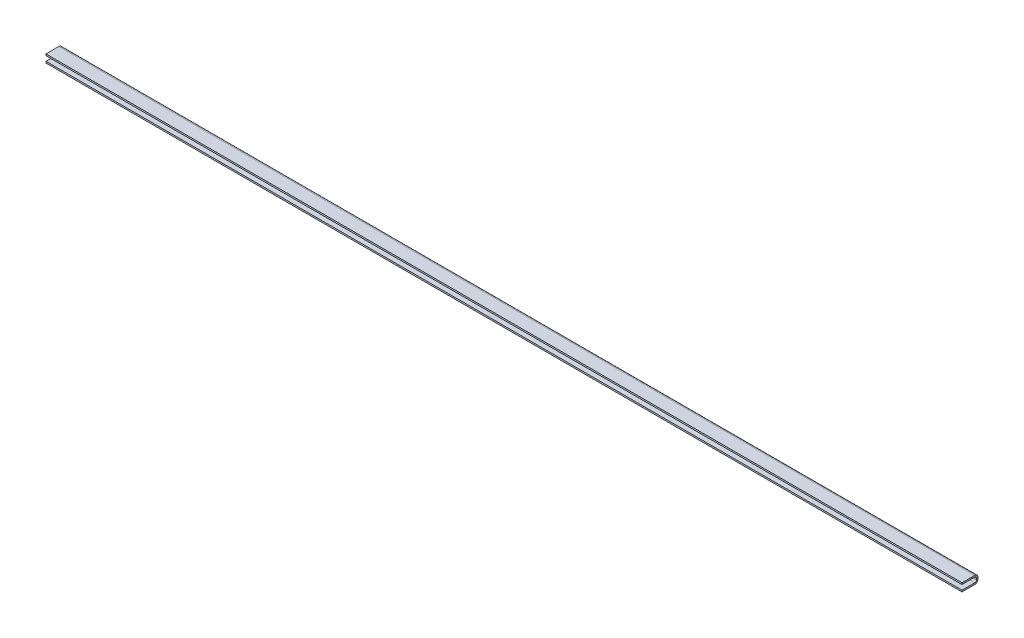
from build123d import *

# Parameters (mm, degrees)
SKETCH_1_W                         = 1144
SKETCH_1_H                         = 10
SM_BASE_FLANGE_1_DEPTH             = 2
SM_EDGE_FLANGE_1_STRIP_W           = 12
SM_EDGE_FLANGE_1_STRIP_H           = 2
SM_EDGE_FLANGE_1_STRIP_CUT_DEPTH   = 1144
SM_EDGE_FLANGE_1_STRIP_2_W         = 12
SM_EDGE_FLANGE_1_STRIP_2_H         = 2
SM_EDGE_FLANGE_1_STRIP_CUT_2_DEPTH = 1144
SM_EDGE_FLANGE_1_DEPTH             = 1144
SM_EDGE_FLANGE_1_BEND_DEPTH        = 1144


# Sheet-metal steps are written as plain solids
with BuildPart() as part:
    # Sketch 1 → 基体-法兰1 (new body)
    with BuildSketch(Plane.XY):
        Rectangle(SKETCH_1_W, SKETCH_1_H)
    extrude(amount=-SM_BASE_FLANGE_1_DEPTH)

    # 边线-法兰1 strip (across the edge) → 边线-法兰1 strip cut (cut)
    with BuildSketch(Plane(origin=(572, 5, 0), x_dir=(0, -1, 0), z_dir=(-1, 0, 0))):
        with Locations((-2, -1)):
            Rectangle(SM_EDGE_FLANGE_1_STRIP_W, SM_EDGE_FLANGE_1_STRIP_H)
    extrude(amount=SM_EDGE_FLANGE_1_STRIP_CUT_DEPTH, mode=Mode.SUBTRACT)

    # 边线-法兰1 strip 2 (across the edge) → 边线-法兰1 strip cut 2 (cut)
    with BuildSketch(Plane(origin=(-572, -5, 0), x_dir=(0, 1, 0), z_dir=(1, 0, 0))):
        with Locations((-2, -1)):
            Rectangle(SM_EDGE_FLANGE_1_STRIP_2_W, SM_EDGE_FLANGE_1_STRIP_2_H)
    extrude(amount=SM_EDGE_FLANGE_1_STRIP_CUT_2_DEPTH, mode=Mode.SUBTRACT)

    # 边线-法兰1 section (across the edge) → 边线-法兰1 (add)
    with BuildSketch(Plane(origin=(572, 5, 0), x_dir=(0, -1, 0), z_dir=(-1, 0, 0))):
        with BuildLine():
            Line((0, 2), (0, 18))
            Line((0, 18), (2, 18))
            Line((2, 18), (2, 2))
            ThreePointArc((2, 2), (2.585786438, 0.585786438), (4, 0))
            Line((4, 0), (4, -2))
            ThreePointArc((4, -2), (1.171572875, -0.828427125), (0, 2))
        make_face()
    extrude(amount=SM_EDGE_FLANGE_1_DEPTH)

    # 边线-法兰1 section 2 (across the edge) → 边线-法兰1 bend (add)
    with BuildSketch(Plane(origin=(-572, -5, 0), x_dir=(0, 1, 0), z_dir=(1, 0, 0))):
        with BuildLine():
            Line((0, 2), (0, 18))
            Line((0, 18), (2, 18))
            Line((2, 18), (2, 2))
            ThreePointArc((2, 2), (2.585786438, 0.585786438), (4, 0))
            Line((4, 0), (4, -2))
            ThreePointArc((4, -2), (1.171572875, -0.828427125), (0, 2))
        make_face()
    extrude(amount=SM_EDGE_FLANGE_1_BEND_DEPTH)


solid = part.part
